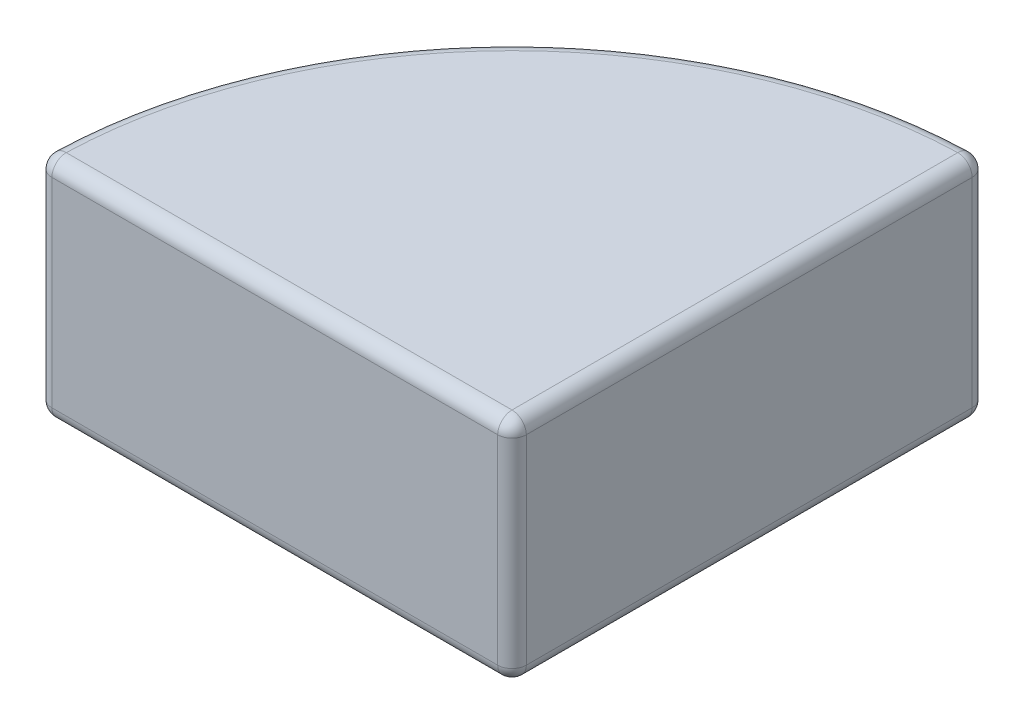
from build123d import *

# Parameters (mm, degrees)
BOSS_EXTRUDE1_DEPTH = 159.4
SHELL1_T            = -20
FILLET1_R           = 10


with BuildPart() as part:
    # Sketch1 → Boss-Extrude1 (new body)
    with BuildSketch(Plane(origin=(0, 0, 0), x_dir=(1, 0, 0), z_dir=(0, 1, 0))):
        with BuildLine():
            Line((0, 0), (-331.6, 0))
            ThreePointArc((-331.6, 0), (-234.476608641, 234.476608641), (0, 331.6))
            Line((0, 331.6), (0, 0))
        make_face()
    extrude(amount=BOSS_EXTRUDE1_DEPTH)

    # Shell1
    shell1_openings = [part.faces().sort_by_distance(p)[0] for p in [
        (-140.735411011, 0, -140.735411011),
    ]]
    offset(amount=SHELL1_T, openings=shell1_openings, kind=Kind.INTERSECTION)

    # Fillet1
    fillet1_edges = [part.edges().sort_by_distance(p)[0] for p in [
        (-20, 0, -165.478744528),
        (-20, 69.7, -20),
        (-165.8, 159.4, 0),
        (-220.334473018, 0, -220.334473018),
        (-20, 69.7, -310.957489056),
        (-165.478744528, 0, -20),
        (-310.957489056, 69.7, -20),
        (-20, 139.4, -165.478744528),
        (-220.334473018, 139.4, -220.334473018),
        (-165.478744528, 139.4, -20),
        (-165.8, 0, 0),
        (-234.476608641, 0, -234.476608641),
        (0, 0, -165.8),
        (0, 159.4, -165.8),
        (0, 79.7, 0),
        (-331.6, 79.7, 0),
        (0, 79.7, -331.6),
        (-234.476608641, 159.4, -234.476608641),
    ]]
    fillet(fillet1_edges, radius=FILLET1_R - 0.0001)  # a hair under: the kernel refuses the full size


solid = part.part
